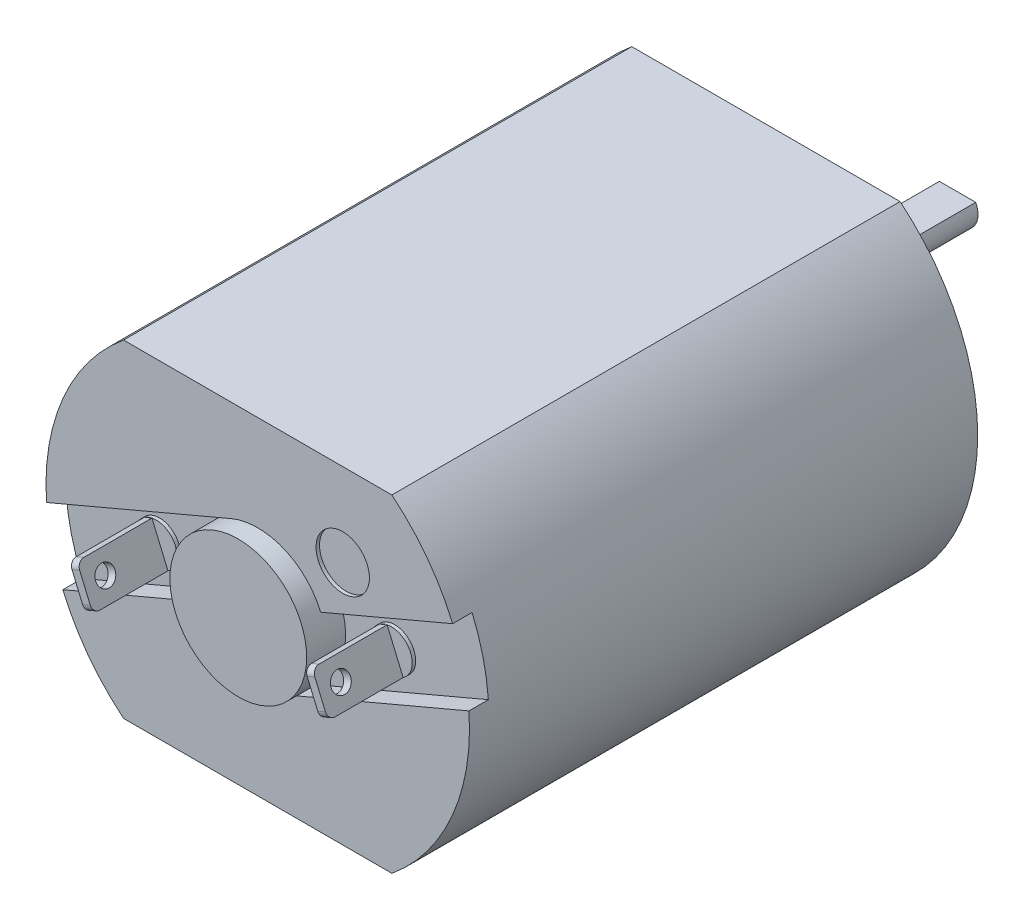
from build123d import *

# Parameters (mm, degrees)
EXTRUDE1_DEPTH     = 18.5928
SKETCH2_R          = 2.3495
EXTRUDE2_DEPTH     = 1.524
SKETCH3_R          = 0.74803
EXTRUDE3_DEPTH     = 5.4864
SKETCH4_R          = 2.5019
EXTRUDE4_DEPTH     = 0.7112
SKETCH6_R          = 0.806604734
SKETCH6_R_2        = 0.8001
CUT_EXTRUDE1_DEPTH = 2
CUT_EXTRUDE2_START = -0.7112
CUT_EXTRUDE2_DEPTH = 0.7112
CUT_EXTRUDE3_START = -0.7112
CUT_EXTRUDE3_DEPTH = 0.7112
EXTRUDE5_DEPTH     = 2.8702
FILLET1_R          = 0.254
SKETCH11_R         = 0.3556
CUT_EXTRUDE4_DEPTH = 0.381
SKETCH12_R         = 0.3556
CUT_EXTRUDE5_DEPTH = 0.381
SKETCH13_R         = 0.764641256
EXTRUDE6_DEPTH     = 0.127
SKETCH14_R         = 0.976393175
EXTRUDE7_DEPTH     = 0.127
EXTRUDE8_START     = -5.207
EXTRUDE8_DEPTH     = 5.207


with BuildPart() as part:
    # Sketch1 → Extrude1 (new body)
    with BuildSketch(Plane.XY):
        with BuildLine():
            Line((-4.907461425, 5.9944), (4.907461425, 5.9944))
            ThreePointArc((4.907461425, 5.9944), (7.747, 0), (4.907461425, -5.9944))
            Line((4.907461425, -5.9944), (-4.907461425, -5.9944))
            ThreePointArc((-4.907461425, -5.9944), (-7.747, 0), (-4.907461425, 5.9944))
        make_face()
    extrude(amount=EXTRUDE1_DEPTH)

    # Sketch2 → Extrude2 (add)
    with BuildSketch(Plane(origin=(0, 0, 0), x_dir=(-1, 0, 0), z_dir=(0, 0, -1))):
        Circle(SKETCH2_R)
    extrude(amount=EXTRUDE2_DEPTH)

    # Sketch3 → Extrude3 (add)
    with BuildSketch(Plane(origin=(0, 0, -1.524), x_dir=(-1, 0, 0), z_dir=(0, 0, -1))):
        Circle(SKETCH3_R)
    extrude(amount=EXTRUDE3_DEPTH)

    # Sketch4 → Extrude4 (add)
    with BuildSketch(Plane.XY.offset(18.5928)):
        Circle(SKETCH4_R)
    extrude(amount=EXTRUDE4_DEPTH)

    # Sketch6 → Cut-Extrude1 (cut)
    with BuildSketch(Plane(origin=(0, 0, 0), x_dir=(-1, 0, 0), z_dir=(0, 0, -1))):
        with Locations((4.333417915, 2.5019)):
            Circle(SKETCH6_R)
        with Locations((-4.333417915, -2.5019)):
            Circle(SKETCH6_R_2)
    extrude(amount=-CUT_EXTRUDE1_DEPTH, mode=Mode.SUBTRACT)

    # Sketch8 → Cut-Extrude2 (cut)
    with BuildSketch(Plane.XY.offset(18.5928).offset(CUT_EXTRUDE2_START)):
        with BuildLine():
            Line((2.303011093, 0.97757021), (7.222442902, 3.065745123))
            Line((7.222442902, 3.065745123), (8.200013112, 0.76273403))
            Line((8.200013112, 0.76273403), (0.97757021, -2.303011093))
            ThreePointArc((0.97757021, -2.303011093), (2.319721286, -0.937228236), (2.303011093, 0.97757021))
        make_face()
    extrude(amount=CUT_EXTRUDE2_DEPTH, mode=Mode.SUBTRACT)

    # Sketch9 → Cut-Extrude3 (cut)
    with BuildSketch(Plane.XY.offset(18.5928).offset(CUT_EXTRUDE3_START)):
        with BuildLine():
            Line((-2.303011093, -0.97757021), (-8.41785865, -3.573169003))
            Line((-8.41785865, -3.573169003), (-9.39542886, -1.27015791))
            Line((-9.39542886, -1.27015791), (-0.97757021, 2.303011093))
            ThreePointArc((-0.97757021, 2.303011093), (-2.319721286, 0.937228236), (-2.303011093, -0.97757021))
        make_face()
    extrude(amount=CUT_EXTRUDE3_DEPTH, mode=Mode.SUBTRACT)

    # Sketch10 → Extrude5 (add)
    with BuildSketch(Plane.XY.offset(17.8816)):
        Polygon((-4.735400216, 0.169832597), (-4.149850547, -1.209635977), (-3.869280668, -1.090541129), (-4.454830337, 0.288927445), align=None)
        Polygon((3.869280668, 1.090541129), (4.149850547, 1.209635977), (4.735400216, -0.169832597), (4.454830337, -0.288927445), align=None)
    extrude(amount=EXTRUDE5_DEPTH)

    # Fillet1
    fillet1_edges = [part.edges().sort_by_distance(p)[0] for p in [
        (4.595115277, -0.229380021, 20.7518),
        (4.009565608, 1.150088553, 20.7518),
        (-4.009565608, -1.150088553, 20.7518),
        (-4.595115277, 0.229380021, 20.7518),
    ]]
    fillet(fillet1_edges, radius=FILLET1_R)

    # Sketch11 → Cut-Extrude4 (cut)
    with BuildSketch(Plane(origin=(-3.951359134, -1.677252442, 0), x_dir=(0, 0, 1), z_dir=(-0.92050485345244, -0.3907311284892747, 0))):
        with Locations((20.001394918, 1.27)):
            Circle(SKETCH11_R)
    extrude(amount=-CUT_EXTRUDE4_DEPTH, mode=Mode.SUBTRACT)

    # Sketch12 → Cut-Extrude5 (cut)
    with BuildSketch(Plane(origin=(3.951359134, 1.677252442, 0), x_dir=(0, 0, -1), z_dir=(0.9205048534524398, 0.3907311284892751, 0))):
        with Locations((-19.9898, -1.2446)):
            Circle(SKETCH12_R)
    extrude(amount=-CUT_EXTRUDE5_DEPTH, mode=Mode.SUBTRACT)

    # Sketch13 → Extrude6 (add)
    with BuildSketch(Plane.XY.offset(17.8816)):
        with Locations((4.302340442, 0.460354266)):
            Circle(SKETCH13_R)
        with Locations((-4.302340442, -0.460354266)):
            Circle(SKETCH13_R)
    extrude(amount=EXTRUDE6_DEPTH)

    # Sketch14 → Extrude7 (cut)
    with BuildSketch(Plane.XY.offset(18.5928)):
        with Locations((3.109494983, 2.955380071)):
            Circle(SKETCH14_R)
    extrude(amount=-EXTRUDE7_DEPTH, mode=Mode.SUBTRACT)

    # Sketch15 → Extrude8 (cut)
    with BuildSketch(Plane(origin=(0, 0, -7.0104), x_dir=(-1, 0, 0), z_dir=(0, 0, -1)).offset(EXTRUDE8_START)):
        with BuildLine():
            Line((-0.664807093, 0.3429), (0.664807093, 0.3429))
            ThreePointArc((0.664807093, 0.3429), (0, 0.74803), (-0.664807093, 0.3429))
        make_face()
    extrude(amount=EXTRUDE8_DEPTH, mode=Mode.SUBTRACT)


solid = part.part
